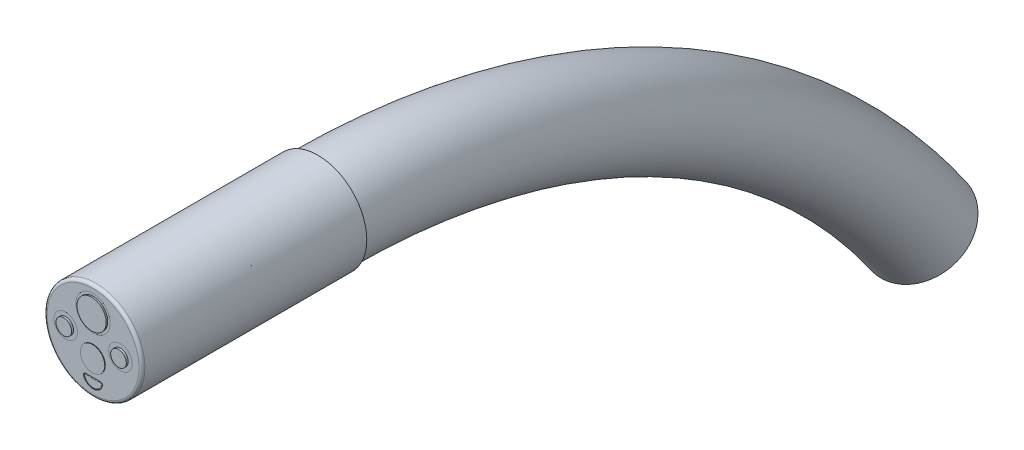
from build123d import *

# Parameters (mm, degrees)
SKETCH1_R      = 5
EXTRUDE1_DEPTH = 23
SKETCH2_R      = 1.5
SKETCH2_R_2    = 1
SKETCH2_R_3    = 1.25
EXTRUDE2_DEPTH = 40
SKETCH3_W      = 10.95
SKETCH3_H      = 0.7
SKETCH_W       = 2.5
SKETCH_H       = 0.25
EXTRUDE3_START = -9.55
SKETCH4_R      = 1.75
EXTRUDE3_DEPTH = 9.55
SKETCH5_W      = 0.2
SKETCH5_H      = 0.2
EXTRUDE4_DEPTH = 25
FILLET2_R      = 0.1
FILLET3_R      = 0.3
SKETCH_3_W     = 3
SKETCH_3_H     = 1.2
SKETCH_4_W     = 2
SKETCH_4_H     = 1.2
SKETCH_5_W     = 1.3
SKETCH_5_H     = 1.2
SKETCH_7_W     = 0.8
SKETCH_7_H     = 1.3
SKETCH_8_W     = 0.5
SKETCH_8_H     = 1
SKETCH9_W      = 4
SKETCH9_H      = 0.3
SKETCH9_W_2    = 0.3
SKETCH9_H_2    = 0.2
SKETCH9_W_3    = 4.8
SKETCH9_H_3    = 0.15
SKETCH10_W     = 0.3
SKETCH10_H     = 0.25
SKETCH10_W_2   = 5.1
SKETCH10_H_2   = 0.15
SKETCH11_W     = 1.5
SKETCH11_H     = 0.45
SKETCH11_W_2   = 0.5
SKETCH11_H_2   = 0.3
SKETCH11_W_3   = 1
SKETCH11_H_3   = 0.23
SKETCH13_R     = 0.125390483
SKETCH_10_R    = 0.212162274
SKETCH15_R     = 1.75
SKETCH15_R_2   = 1.5
EXTRUDE5_DEPTH = 9.55
SKETCH16_R     = 0.6
EXTRUDE6_DEPTH = 15
EXTRUDE7_START = 0.05
SKETCH17_R     = 1.25
EXTRUDE7_DEPTH = 0.5
SKETCH18_R     = 0.9
EXTRUDE8_DEPTH = 25
SKETCH19_W     = 3.5
SKETCH19_H     = 0.8
SKETCH19_W_2   = 19.7
SKETCH19_H_2   = 0.25
SKETCH20_W     = 0.2
SKETCH20_H     = 0.4
SKETCH20_H_2   = 0.55
SKETCH21_W     = 3.5
SKETCH21_H     = 0.8
SKETCH21_W_2   = 19.7
SKETCH21_H_2   = 0.25
SKETCH22_W     = 0.2
SKETCH22_H     = 0.4
SKETCH22_H_2   = 0.55
SKETCH23_R     = 4.7
SKETCH23_R_2   = 4.25


with BuildPart() as part:
    # Sketch1 → Extrude1 (new body)
    with BuildSketch(Plane.XY):
        Circle(SKETCH1_R)
    extrude(amount=EXTRUDE1_DEPTH)

    # Sketch2 → Extrude2 (cut)
    with BuildSketch(Plane.XY.offset(23)):
        with Locations((0, 2.5)):
            Circle(SKETCH2_R)
        with Locations((2.8, 0)):
            Circle(SKETCH2_R_2)
        with Locations((0, -1.5)):
            Circle(SKETCH2_R_3)
        with Locations((-2.8, 0)):
            Circle(SKETCH2_R_2)
        with BuildLine():
            Line((-0.774596669, -3.2), (0.774596669, -3.2))
            ThreePointArc((0.774596669, -3.2), (0.932710552, -3.277525513), (0.968245837, -3.45))
            ThreePointArc((0.968245837, -3.45), (0, -4.2), (-0.968245837, -3.45))
            ThreePointArc((-0.968245837, -3.45), (-0.932710552, -3.277525513), (-0.774596669, -3.2))
        make_face()
    extrude(amount=-EXTRUDE2_DEPTH, mode=Mode.SUBTRACT)

    # Sketch3 → Revolve1 (revolve)
    with BuildSketch(Plane(origin=(0, 0, 0), x_dir=(0, 0, -1), z_dir=(1, 0, 0)), mode=Mode.PRIVATE) as revolve1_sk:
        with Locations((-5.475, 3.65)):
            Rectangle(SKETCH3_W, SKETCH3_H)
    revolve(revolve1_sk.sketch.rotate(Axis((0, 2.5, 4.233828538), (0, 0, 1)), 270), axis=Axis((0, 2.5, 4.233828538), (0, 0, 1)))

    # Sketch → Cut-Revolve1 (revolve, cut)
    with BuildSketch(Plane(origin=(0, 0, 0), x_dir=(0, 0, -1), z_dir=(1, 0, 0)), mode=Mode.PRIVATE) as cut_revolve1_sk:
        with Locations((-12.2, 4.125)):
            Rectangle(SKETCH_W, SKETCH_H)
    revolve(cut_revolve1_sk.sketch.rotate(Axis((0, 2.5, 4.233828538), (0, 0, 1)), 90), axis=Axis((0, 2.5, 4.233828538), (0, 0, 1)), mode=Mode.SUBTRACT)

    # Sketch4 → Extrude3 (cut)
    with BuildSketch(Plane.XY.offset(23).offset(EXTRUDE3_START)):
        with Locations(Location((0, 2.5, 0), (0, 0, 180))):
            Circle(SKETCH4_R)
    extrude(amount=EXTRUDE3_DEPTH, mode=Mode.SUBTRACT)

    # Sketch5 → Cut-Revolve2 (revolve, cut)
    with BuildSketch(Plane(origin=(-2.8, 0, 0), x_dir=(0, 0, -1), z_dir=(1, 0, 0)), mode=Mode.PRIVATE) as cut_revolve2_sk:
        with Locations((-22.9, 1.1)):
            Rectangle(SKETCH5_W, SKETCH5_H)
    cut_revolve2 = revolve(cut_revolve2_sk.sketch.rotate(Axis((-2.8, 0, 23), (0, 0, -1)), 90), axis=Axis((-2.8, 0, 23), (0, 0, -1)), mode=Mode.SUBTRACT)

    # Mirror1: Cut-Revolve2 across plane
    add(cut_revolve2.mirror(Plane(origin=(0, 0, 0), x_dir=(0, 0, 1), z_dir=(1, 0, 0))), mode=Mode.SUBTRACT)

    # Fillet3
    fillet3_edges = [part.edges().sort_by_distance(p)[0] for p in [
        (-5, 0, 23),
    ]]
    fillet(fillet3_edges, radius=FILLET3_R)


with BuildPart() as body_2:
    # Sketch6 → Extrude4 (new body)
    with BuildSketch(Plane.XY.offset(23)):
        with BuildLine():
            Line((0.774596669, -3.2), (-0.774596669, -3.2))
            ThreePointArc((-0.774596669, -3.2), (-0.932710552, -3.277525513), (-0.968245837, -3.45))
            ThreePointArc((-0.968245837, -3.45), (0, -4.2), (0.968245837, -3.45))
            ThreePointArc((0.968245837, -3.45), (0.932710552, -3.277525513), (0.774596669, -3.2))
        make_face()
    extrude(amount=-EXTRUDE4_DEPTH)

    # Fillet2
    fillet2_edges = [body_2.edges().sort_by_distance(p)[0] for p in [
        (0, -3.2, 23),
        (0.932710552, -3.277525513, 23),
        (0, -4.2, 23),
        (-0.932710552, -3.277525513, 23),
    ]]
    fillet(fillet2_edges, radius=FILLET2_R)


with BuildPart() as body_3:
    # Sketch7 → Revolve2 (revolve)
    with BuildSketch(Plane(origin=(0, 0, 0), x_dir=(0, 0, -1), z_dir=(1, 0, 0))):
        with BuildLine():
            Line((-22.55, 4), (-23.15, 4))
            Line((-23.15, 4), (-23.15, 2.5))
            Line((-23.15, 2.5), (-22.85, 2.5))
            ThreePointArc((-22.85, 2.5), (-22.771954446, 2.887298335), (-22.55, 3.214142843))
            Line((-22.55, 3.214142843), (-22.55, 3.7))
            Line((-22.55, 3.7), (-22.55, 4))
        make_face()
    revolve(axis=Axis((0, 2.5, 30.341573658), (0, 0, -1)))


with BuildPart() as body_4:
    # Sketch 2 → Revolve3 (revolve)
    with BuildSketch(Plane(origin=(0, 0, 0), x_dir=(0, 0, -1), z_dir=(1, 0, 0)), mode=Mode.PRIVATE) as revolve3_sk:
        Polygon((-22.15, 3.7), (-22.55, 3.7), (-22.55, 3.214142843), (-22.55, 2.5), (-22.15, 2.5), align=None)
    revolve(revolve3_sk.sketch.rotate(Axis((0, 2.5, 30.341573658), (0, 0, -1)), 90), axis=Axis((0, 2.5, 30.341573658), (0, 0, -1)))


with BuildPart() as body_5:
    # Sketch 3 → Revolve4 (revolve)
    with BuildSketch(Plane(origin=(0, 0, 0), x_dir=(0, 0, -1), z_dir=(1, 0, 0))):
        with Locations((-20.35, 3.1)):
            Rectangle(SKETCH_3_W, SKETCH_3_H)
        with BuildLine():
            ThreePointArc((-18.85, 3.7), (-18.69130037, 3.109303883), (-18.637856445, 2.5))
            Line((-18.637856445, 2.5), (-18.85, 2.5))
            Line((-18.85, 2.5), (-18.85, 3.7))
        make_face()
    revolve(axis=Axis((0, 2.5, 21.85), (0, 0, -1)))


with BuildPart() as body_6:
    # Sketch 4 → Revolve5 (revolve)
    with BuildSketch(Plane(origin=(0, 0, 0), x_dir=(0, 0, -1), z_dir=(1, 0, 0)), mode=Mode.PRIVATE) as revolve5_sk:
        with Locations((-17.55, 3.1)):
            Rectangle(SKETCH_4_W, SKETCH_4_H)
    revolve(revolve5_sk.sketch.rotate(Axis((0, 2.5, 18.55), (0, 0, -1)), 90), axis=Axis((0, 2.5, 18.55), (0, 0, -1)))


with BuildPart() as body_7:
    # Sketch 5 → Revolve6 (revolve)
    with BuildSketch(Plane(origin=(0, 0, 0), x_dir=(0, 0, -1), z_dir=(1, 0, 0))):
        with Locations((-15.4, 3.1)):
            Rectangle(SKETCH_5_W, SKETCH_5_H)
        with BuildLine():
            ThreePointArc((-14.75, 3.7), (-14.383002069, 3.149202943), (-14.254159458, 2.5))
            Line((-14.254159458, 2.5), (-14.75, 2.5))
            Line((-14.75, 2.5), (-14.75, 3.7))
        make_face()
        with BuildLine():
            Line((-16.05, 2.5), (-16.05, 3.7))
            ThreePointArc((-16.05, 3.7), (-16.204042265, 3.108767123), (-16.25588745, 2.5))
            Line((-16.25588745, 2.5), (-16.05, 2.5))
        make_face()
    revolve(axis=Axis((0, 2.5, 16.05), (0, 0, -1)))


with BuildPart() as body_8:
    # Sketch 6 → Revolve7 (revolve)
    with BuildSketch(Plane(origin=(0, 0, 0), x_dir=(0, 0, -1), z_dir=(1, 0, 0)), mode=Mode.PRIVATE) as revolve7_sk:
        with BuildLine():
            Line((-14.75, 3.7), (-13.75, 3.7))
            Line((-13.75, 3.7), (-13.75, 2.5))
            Line((-13.75, 2.5), (-14.254159458, 2.5))
            ThreePointArc((-14.254159458, 2.5), (-14.383002069, 3.149202943), (-14.75, 3.7))
        make_face()
    revolve(revolve7_sk.sketch.rotate(Axis((0, 2.5, 13.75), (0, 0, 1)), 270), axis=Axis((0, 2.5, 13.75), (0, 0, 1)))


with BuildPart() as body_9:
    # Sketch 7 → Revolve8 (revolve)
    with BuildSketch(Plane(origin=(0, 0, 0), x_dir=(0, 0, -1), z_dir=(1, 0, 0)), mode=Mode.PRIVATE) as revolve8_sk:
        with Locations((-13.05, 3.15)):
            Rectangle(SKETCH_7_W, SKETCH_7_H)
    revolve(revolve8_sk.sketch.rotate(Axis((0, 2.5, 13.45), (0, 0, -1)), 90), axis=Axis((0, 2.5, 13.45), (0, 0, -1)))


with BuildPart() as body_10:
    # Sketch 8 → Revolve9 (revolve)
    with BuildSketch(Plane(origin=(0, 0, 0), x_dir=(0, 0, -1), z_dir=(1, 0, 0)), mode=Mode.PRIVATE) as revolve9_sk:
        with Locations((-12.4, 3)):
            Rectangle(SKETCH_8_W, SKETCH_8_H)
    revolve(revolve9_sk.sketch.rotate(Axis((0, 2.5, 12.65), (0, 0, -1)), 90), axis=Axis((0, 2.5, 12.65), (0, 0, -1)))


with BuildPart() as body_11:
    # Sketch9 → Revolve11 (revolve)
    with BuildSketch(Plane(origin=(0, 0, 0), x_dir=(0, 0, -1), z_dir=(1, 0, 0)), mode=Mode.PRIVATE) as revolve11_sk:
        with Locations((-20.55, 3.85)):
            Rectangle(SKETCH9_W, SKETCH9_H)
        with Locations((-22, 3.6)):
            Rectangle(SKETCH9_W_2, SKETCH9_H_2)
        with Locations((-16.15, 3.775)):
            Rectangle(SKETCH9_W_3, SKETCH9_H_3)
    revolve(revolve11_sk.sketch.rotate(Axis((0, 2.5, 20.657143519), (0, 0, 1)), 90), axis=Axis((0, 2.5, 20.657143519), (0, 0, 1)))


with BuildPart() as body_12:
    # Sketch10 → Revolve12 (revolve)
    with BuildSketch(Plane(origin=(0, 0, 0), x_dir=(0, 0, -1), z_dir=(1, 0, 0)), mode=Mode.PRIVATE) as revolve12_sk:
        with Locations((-13.6, 3.725)):
            Rectangle(SKETCH10_W, SKETCH10_H)
        with Locations((-16, 3.925)):
            Rectangle(SKETCH10_W_2, SKETCH10_H_2)
    revolve(revolve12_sk.sketch.rotate(Axis((0, 2.5, 20.657143519), (0, 0, -1)), 90), axis=Axis((0, 2.5, 20.657143519), (0, 0, -1)))


with BuildPart() as body_13:
    # Sketch11 → Revolve13 (revolve)
    with BuildSketch(Plane(origin=(0, 0, 0), x_dir=(0, 0, -1), z_dir=(1, 0, 0)), mode=Mode.PRIVATE) as revolve13_sk:
        with Locations((-12.7, 4.025)):
            Rectangle(SKETCH11_W, SKETCH11_H)
        with Locations((-12.4, 3.65)):
            Rectangle(SKETCH11_W_2, SKETCH11_H_2)
        Polygon((-11.95, 3.8), (-12.15, 3.8), (-12.15, 3.5), (-12.15, 3.45), (-11.95, 3.45), align=None)
        with Locations((-11.45, 4.135)):
            Rectangle(SKETCH11_W_3, SKETCH11_H_3)
    revolve(revolve13_sk.sketch.rotate(Axis((0, 2.5, 17.901712112), (0, 0, -1)), 90), axis=Axis((0, 2.5, 17.901712112), (0, 0, -1)))


with BuildPart() as body_14:
    # Sketch 9 → Revolve14 (revolve)
    with BuildSketch(Plane(origin=(0, 0, 0), x_dir=(0, 0, -1), z_dir=(1, 0, 0)), mode=Mode.PRIVATE) as revolve14_sk:
        Polygon((-11.95, 4.02), (-11.95, 3.8), (-11.95, 3.45), (-11.95, 2.5), (-10.95, 2.5), (-10.95, 4.02), align=None)
    revolve(revolve14_sk.sketch.rotate(Axis((0, 2.5, 17.901712112), (0, 0, -1)), 180), axis=Axis((0, 2.5, 17.901712112), (0, 0, -1)))


with BuildPart() as body_15:
    # Sketch13 → Revolve15 (revolve)
    with BuildSketch(Plane(origin=(0, 0, 0), x_dir=(0, 0, -1), z_dir=(1, 0, 0)), mode=Mode.PRIVATE) as revolve15_sk:
        with Locations((-18.675390483, 3.574609517)):
            Circle(SKETCH13_R)
    revolve(revolve15_sk.sketch.rotate(Axis((0, 2.5, 18.675390483), (0, 0, 1)), 270), axis=Axis((0, 2.5, 18.675390483), (0, 0, 1)))


with BuildPart() as body_16:
    # Sketch 10 → Revolve16 (revolve)
    with BuildSketch(Plane(origin=(0, 0, 0), x_dir=(0, 0, -1), z_dir=(1, 0, 0)), mode=Mode.PRIVATE) as revolve16_sk:
        with Locations((-16.337837726, 3.487837726)):
            Circle(SKETCH_10_R)
    revolve(revolve16_sk.sketch.rotate(Axis((0, 2.5, 18.55), (0, 0, 1)), 270), axis=Axis((0, 2.5, 18.55), (0, 0, 1)))


with BuildPart() as body_17:
    # Sketch15 → Extrude5 (new body)
    with BuildSketch(Plane.XY.offset(23)):
        with Locations((0, 2.5)):
            Circle(SKETCH15_R)
        with Locations((0, 2.5)):
            Circle(SKETCH15_R_2, mode=Mode.SUBTRACT)
    extrude(amount=-EXTRUDE5_DEPTH)


with BuildPart() as body_18:
    # Sketch16 → Extrude6 (new body)
    with BuildSketch(Plane(origin=(0, 0, 10.95), x_dir=(-1, 0, 0), z_dir=(0, 0, -1))):
        with Locations((0, 2.5)):
            Circle(SKETCH16_R)
    extrude(amount=EXTRUDE6_DEPTH)


with BuildPart() as body_19:
    # Sketch17 → Extrude7 (new body)
    with BuildSketch(Plane.XY.offset(23).offset(EXTRUDE7_START)):
        with Locations((0, -1.5)):
            Circle(SKETCH17_R)
    extrude(amount=-EXTRUDE7_DEPTH)


with BuildPart() as body_20:
    # Sketch18 → Extrude8 (new body)
    with BuildSketch(Plane(origin=(0, 0, 22.55), x_dir=(-1, 0, 0), z_dir=(0, 0, -1))):
        with Locations((0, -1.5)):
            Circle(SKETCH18_R)
    extrude(amount=EXTRUDE8_DEPTH)


with BuildPart() as body_21:
    # Sketch19 → Revolve17 (revolve)
    with BuildSketch(Plane(origin=(-2.8, 0, 0), x_dir=(0, 0, -1), z_dir=(1, 0, 0)), mode=Mode.PRIVATE) as revolve17_sk:
        with Locations((-21.45, 0.4)):
            Rectangle(SKETCH19_W, SKETCH19_H)
        with Locations((-9.85, 0.125)):
            Rectangle(SKETCH19_W_2, SKETCH19_H_2)
    revolve(revolve17_sk.sketch.rotate(Axis((-2.8, 0, 23.2), (0, 0, -1)), 90), axis=Axis((-2.8, 0, 23.2), (0, 0, -1)))


with BuildPart() as body_22:
    # Sketch20 → Revolve18 (revolve)
    with BuildSketch(Plane(origin=(-2.8, 0, 0), x_dir=(0, 0, -1), z_dir=(1, 0, 0)), mode=Mode.PRIVATE) as revolve18_sk:
        with Locations((-22.9, 1)):
            Rectangle(SKETCH20_W, SKETCH20_H)
        Polygon((-22.8, 1), (-22.8, 0.8), (-19.7, 0.8), (-19.5, 0.8), (-19.5, 1), align=None)
        with Locations((-19.6, 0.525)):
            Rectangle(SKETCH20_W, SKETCH20_H_2)
    revolve(revolve18_sk.sketch.rotate(Axis((-2.8, 0, 18.425457789), (0, 0, 1)), 90), axis=Axis((-2.8, 0, 18.425457789), (0, 0, 1)))


with BuildPart() as body_23:
    # Sketch21 → Revolve19 (revolve)
    with BuildSketch(Plane(origin=(2.8, 0, 0), x_dir=(0, 0, -1), z_dir=(1, 0, 0)), mode=Mode.PRIVATE) as revolve19_sk:
        with Locations((-21.45, 0.4)):
            Rectangle(SKETCH21_W, SKETCH21_H)
        with Locations((-9.85, 0.125)):
            Rectangle(SKETCH21_W_2, SKETCH21_H_2)
    revolve(revolve19_sk.sketch.rotate(Axis((2.8, 0, 23.2), (0, 0, -1)), 90), axis=Axis((2.8, 0, 23.2), (0, 0, -1)))


with BuildPart() as body_24:
    # Sketch22 → Revolve20 (revolve)
    with BuildSketch(Plane(origin=(2.8, 0, 0), x_dir=(0, 0, -1), z_dir=(1, 0, 0)), mode=Mode.PRIVATE) as revolve20_sk:
        with Locations((-22.9, 1)):
            Rectangle(SKETCH22_W, SKETCH22_H)
        Polygon((-19.7, 0.8), (-19.5, 0.8), (-19.5, 1), (-22.8, 1), (-22.8, 0.8), align=None)
        with Locations((-19.6, 0.525)):
            Rectangle(SKETCH22_W, SKETCH22_H_2)
    revolve(revolve20_sk.sketch.rotate(Axis((2.8, 0, 18.425457789), (0, 0, 1)), 90), axis=Axis((2.8, 0, 18.425457789), (0, 0, 1)))


with BuildPart() as body_25:
    # Sweep1: sweep along a path in Sketch24
    with BuildLine(Plane(origin=(0, 0, 0), x_dir=(0, 0, -1), z_dir=(1, 0, 0))) as sweep1_path:
        ThreePointArc((0, 0), (34.641016151, -8.479326522), (61.449165983, -32))
    # Sketch23 → Sweep1 (sweep)
    with BuildSketch(Plane(origin=(0, 0, 0), x_dir=(-1, 0, 0), z_dir=(0, 0, -1))):
        Circle(SKETCH23_R)
        Circle(SKETCH23_R_2, mode=Mode.SUBTRACT)
    sweep(path=sweep1_path.line)


solid = Compound([part.part, body_2.part, body_3.part, body_4.part, body_5.part, body_6.part, body_7.part, body_8.part, body_9.part, body_10.part, body_11.part, body_12.part, body_13.part, body_14.part, body_15.part, body_16.part, body_17.part, body_18.part, body_19.part, body_20.part, body_21.part, body_22.part, body_23.part, body_24.part, body_25.part])
